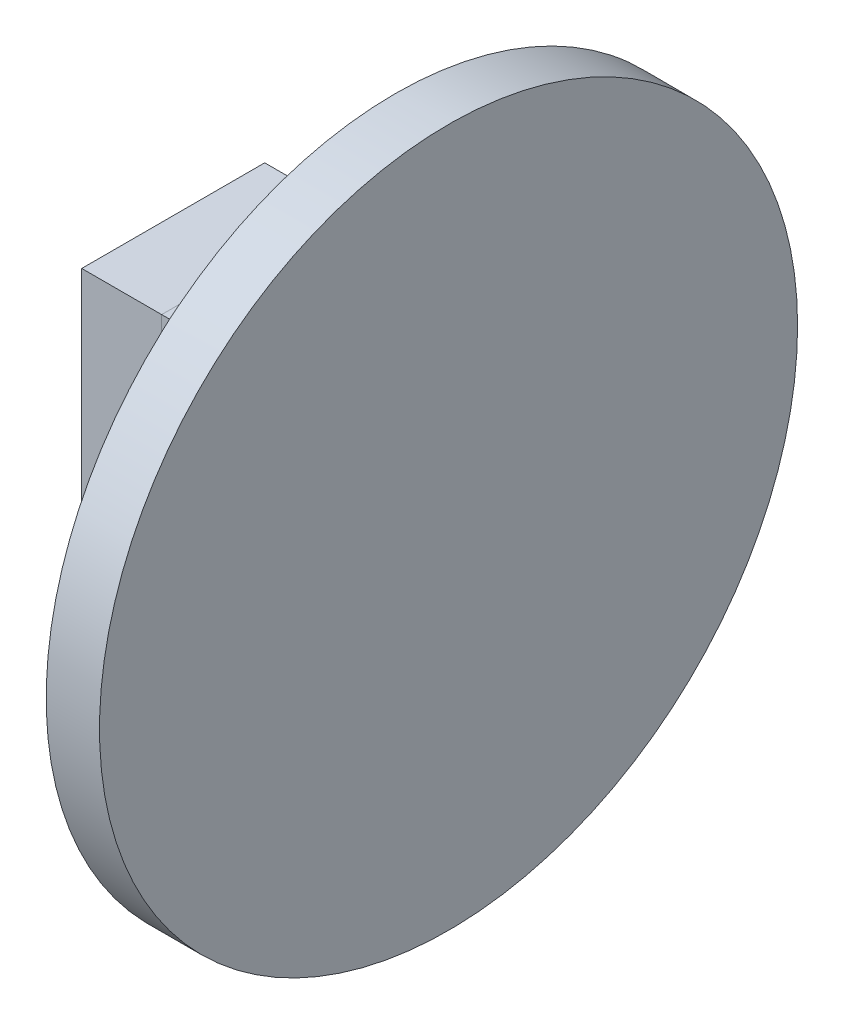
from build123d import *

# Parameters (mm, degrees)
SKETCH2_R           = 19.65
BOSS_EXTRUDE1_DEPTH = 3
SKETCH3_W           = 12.5
SKETCH3_H           = 14.9
BOSS_EXTRUDE2_DEPTH = 5.15
SKETCH4_W           = 7.4
SKETCH4_H           = 12.6
CUT_EXTRUDE1_DEPTH  = 12.5
FILLET1_SIZE        = 8


with BuildPart() as part:
    # Sketch2 → Boss-Extrude1 (new body)
    with BuildSketch(Plane(origin=(0, 0, 0), x_dir=(0, 0, -1), z_dir=(1, 0, 0))):
        Circle(SKETCH2_R)
    extrude(amount=BOSS_EXTRUDE1_DEPTH)

    # Sketch3 → Boss-Extrude2 (add, symmetric)
    with BuildSketch(Plane.XY):
        with Locations((-6.25, 0)):
            Rectangle(SKETCH3_W, SKETCH3_H)
    extrude(amount=BOSS_EXTRUDE2_DEPTH, both=True)

    # Sketch4 → Cut-Extrude1 (cut)
    with BuildSketch(Plane.ZY.offset(12.5)):
        Rectangle(SKETCH4_W, SKETCH4_H)
    extrude(amount=-CUT_EXTRUDE1_DEPTH, mode=Mode.SUBTRACT)

    # Fillet1
    # a fillet whose section is not a circle: 8 mm, written as the material it adds along each edge
    with BuildSketch(Plane(origin=(0, 7.45, 5.15), x_dir=(0, 1, 0), z_dir=(0, 0, -1))) as fillet1_piece_1:
        with BuildLine():
            Bezier((FILLET1_SIZE, 0), (0, 0), (0, -FILLET1_SIZE), weights=[1, 1, 1])
            Line((0, -FILLET1_SIZE), (0, 0))
            Line((0, 0), (FILLET1_SIZE, 0))
        make_face()
    extrude(amount=10.3)
    with BuildSketch(Plane(origin=(0, -7.45, 5.15), x_dir=(0, 0, 1), z_dir=(0, 1, 0))) as fillet1_piece_2:
        with BuildLine():
            Bezier((FILLET1_SIZE, 0), (0, 0), (0, -FILLET1_SIZE), weights=[1, 1, 1])
            Line((0, -FILLET1_SIZE), (0, 0))
            Line((0, 0), (FILLET1_SIZE, 0))
        make_face()
    extrude(amount=14.9)
    with BuildSketch(Plane(origin=(0, -7.45, 5.15), x_dir=(0, -1, 0), z_dir=(0, 0, -1))) as fillet1_piece_3:
        with BuildLine():
            Bezier((FILLET1_SIZE, 0), (0, 0), (0, FILLET1_SIZE), weights=[1, 1, 1])
            Line((0, FILLET1_SIZE), (0, 0))
            Line((0, 0), (FILLET1_SIZE, 0))
        make_face()
    extrude(amount=10.3)
    with BuildSketch(Plane(origin=(0, -7.45, -5.15), x_dir=(0, 0, -1), z_dir=(0, 1, 0))) as fillet1_piece_4:
        with BuildLine():
            Bezier((FILLET1_SIZE, 0), (0, 0), (0, FILLET1_SIZE), weights=[1, 1, 1])
            Line((0, FILLET1_SIZE), (0, 0))
            Line((0, 0), (FILLET1_SIZE, 0))
        make_face()
    extrude(amount=14.9)
    with BuildSketch(Plane(origin=(0, -7.45, 5.15), x_dir=(0, 0, 1), z_dir=(0, 1, 0))) as fillet1_piece_5a_section:
        with BuildLine():
            Bezier((FILLET1_SIZE, 0), (0, 0), (0, -FILLET1_SIZE), weights=[1, 1, 1])
            Line((0, -FILLET1_SIZE), (0, 0))
            Line((0, 0), (FILLET1_SIZE, 0))
        make_face()
    fillet1_piece_5a = extrude(amount=34.9, mode=Mode.PRIVATE)
    fillet1_piece_5a = fillet1_piece_5a & Plane(origin=(0, 0, 0), x_dir=(0, 0, -1), z_dir=(-1, 0, 0)) * Cylinder(19.65, 102, mode=Mode.PRIVATE)
    fillet1_piece_5a = split(fillet1_piece_5a, bisect_by=Plane(origin=(0, 7.45, 5.15), z_dir=(0, 1, 0)), keep=Keep.TOP, mode=Mode.PRIVATE)
    with BuildSketch(Plane(origin=(0, 7.45, 25.15), x_dir=(0, 1, 0), z_dir=(0, 0, -1))) as fillet1_piece_5b_section:
        with BuildLine():
            Bezier((FILLET1_SIZE, 0), (0, 0), (0, -FILLET1_SIZE), weights=[1, 1, 1])
            Line((0, -FILLET1_SIZE), (0, 0))
            Line((0, 0), (FILLET1_SIZE, 0))
        make_face()
    fillet1_piece_5b = extrude(amount=30.3, mode=Mode.PRIVATE)
    fillet1_piece_5b = fillet1_piece_5b & Plane(origin=(0, 0, 0), x_dir=(0, 0, -1), z_dir=(-1, 0, 0)) * Cylinder(19.65, 93, mode=Mode.PRIVATE)
    fillet1_piece_5b = split(fillet1_piece_5b, bisect_by=Plane(origin=(0, 7.45, 5.15), z_dir=(0, 0, 1)), keep=Keep.TOP, mode=Mode.PRIVATE)
    fillet1_piece_5 = fillet1_piece_5a & fillet1_piece_5b
    add(fillet1_piece_5)
    with BuildSketch(Plane(origin=(0, -7.45, -5.15), x_dir=(0, 0, -1), z_dir=(0, 1, 0))) as fillet1_piece_6a_section:
        with BuildLine():
            Bezier((FILLET1_SIZE, 0), (0, 0), (0, FILLET1_SIZE), weights=[1, 1, 1])
            Line((0, FILLET1_SIZE), (0, 0))
            Line((0, 0), (FILLET1_SIZE, 0))
        make_face()
    fillet1_piece_6a = extrude(amount=34.9, mode=Mode.PRIVATE)
    fillet1_piece_6a = fillet1_piece_6a & Plane(origin=(0, 0, 0), x_dir=(0, 0, -1), z_dir=(-1, 0, 0)) * Cylinder(19.65, 102, mode=Mode.PRIVATE)
    fillet1_piece_6a = split(fillet1_piece_6a, bisect_by=Plane(origin=(0, 7.45, -5.15), z_dir=(0, 1, 0)), keep=Keep.TOP, mode=Mode.PRIVATE)
    with BuildSketch(Plane(origin=(0, 7.45, 5.15), x_dir=(0, 1, 0), z_dir=(0, 0, -1))) as fillet1_piece_6b_section:
        with BuildLine():
            Bezier((FILLET1_SIZE, 0), (0, 0), (0, -FILLET1_SIZE), weights=[1, 1, 1])
            Line((0, -FILLET1_SIZE), (0, 0))
            Line((0, 0), (FILLET1_SIZE, 0))
        make_face()
    fillet1_piece_6b = extrude(amount=30.3, mode=Mode.PRIVATE)
    fillet1_piece_6b = fillet1_piece_6b & Plane(origin=(0, 0, 0), x_dir=(0, 0, -1), z_dir=(-1, 0, 0)) * Cylinder(19.65, 93, mode=Mode.PRIVATE)
    fillet1_piece_6b = split(fillet1_piece_6b, bisect_by=Plane(origin=(0, 7.45, -5.15), z_dir=(0, 0, -1)), keep=Keep.TOP, mode=Mode.PRIVATE)
    fillet1_piece_6 = fillet1_piece_6a & fillet1_piece_6b
    add(fillet1_piece_6)
    with BuildSketch(Plane(origin=(0, -27.45, 5.15), x_dir=(0, 0, 1), z_dir=(0, 1, 0))) as fillet1_piece_7a_section:
        with BuildLine():
            Bezier((FILLET1_SIZE, 0), (0, 0), (0, -FILLET1_SIZE), weights=[1, 1, 1])
            Line((0, -FILLET1_SIZE), (0, 0))
            Line((0, 0), (FILLET1_SIZE, 0))
        make_face()
    fillet1_piece_7a = extrude(amount=34.9, mode=Mode.PRIVATE)
    fillet1_piece_7a = fillet1_piece_7a & Plane(origin=(0, 0, 0), x_dir=(0, 0, -1), z_dir=(-1, 0, 0)) * Cylinder(19.65, 102, mode=Mode.PRIVATE)
    fillet1_piece_7a = split(fillet1_piece_7a, bisect_by=Plane(origin=(0, -7.45, 5.15), z_dir=(0, -1, 0)), keep=Keep.TOP, mode=Mode.PRIVATE)
    with BuildSketch(Plane(origin=(0, -7.45, 25.15), x_dir=(0, -1, 0), z_dir=(0, 0, -1))) as fillet1_piece_7b_section:
        with BuildLine():
            Bezier((FILLET1_SIZE, 0), (0, 0), (0, FILLET1_SIZE), weights=[1, 1, 1])
            Line((0, FILLET1_SIZE), (0, 0))
            Line((0, 0), (FILLET1_SIZE, 0))
        make_face()
    fillet1_piece_7b = extrude(amount=30.3, mode=Mode.PRIVATE)
    fillet1_piece_7b = fillet1_piece_7b & Plane(origin=(0, 0, 0), x_dir=(0, 0, -1), z_dir=(-1, 0, 0)) * Cylinder(19.65, 93, mode=Mode.PRIVATE)
    fillet1_piece_7b = split(fillet1_piece_7b, bisect_by=Plane(origin=(0, -7.45, 5.15), z_dir=(0, 0, 1)), keep=Keep.TOP, mode=Mode.PRIVATE)
    fillet1_piece_7 = fillet1_piece_7a & fillet1_piece_7b
    add(fillet1_piece_7)
    with BuildSketch(Plane(origin=(0, -7.45, 5.15), x_dir=(0, -1, 0), z_dir=(0, 0, -1))) as fillet1_piece_8a_section:
        with BuildLine():
            Bezier((FILLET1_SIZE, 0), (0, 0), (0, FILLET1_SIZE), weights=[1, 1, 1])
            Line((0, FILLET1_SIZE), (0, 0))
            Line((0, 0), (FILLET1_SIZE, 0))
        make_face()
    fillet1_piece_8a = extrude(amount=30.3, mode=Mode.PRIVATE)
    fillet1_piece_8a = fillet1_piece_8a & Plane(origin=(0, 0, 0), x_dir=(0, 0, -1), z_dir=(-1, 0, 0)) * Cylinder(19.65, 93, mode=Mode.PRIVATE)
    fillet1_piece_8a = split(fillet1_piece_8a, bisect_by=Plane(origin=(0, -7.45, -5.15), z_dir=(0, 0, -1)), keep=Keep.TOP, mode=Mode.PRIVATE)
    with BuildSketch(Plane(origin=(0, -27.45, -5.15), x_dir=(0, 0, -1), z_dir=(0, 1, 0))) as fillet1_piece_8b_section:
        with BuildLine():
            Bezier((FILLET1_SIZE, 0), (0, 0), (0, FILLET1_SIZE), weights=[1, 1, 1])
            Line((0, FILLET1_SIZE), (0, 0))
            Line((0, 0), (FILLET1_SIZE, 0))
        make_face()
    fillet1_piece_8b = extrude(amount=34.9, mode=Mode.PRIVATE)
    fillet1_piece_8b = fillet1_piece_8b & Plane(origin=(0, 0, 0), x_dir=(0, 0, -1), z_dir=(-1, 0, 0)) * Cylinder(19.65, 102, mode=Mode.PRIVATE)
    fillet1_piece_8b = split(fillet1_piece_8b, bisect_by=Plane(origin=(0, -7.45, -5.15), z_dir=(0, -1, 0)), keep=Keep.TOP, mode=Mode.PRIVATE)
    fillet1_piece_8 = fillet1_piece_8a & fillet1_piece_8b
    add(fillet1_piece_8)


solid = part.part
